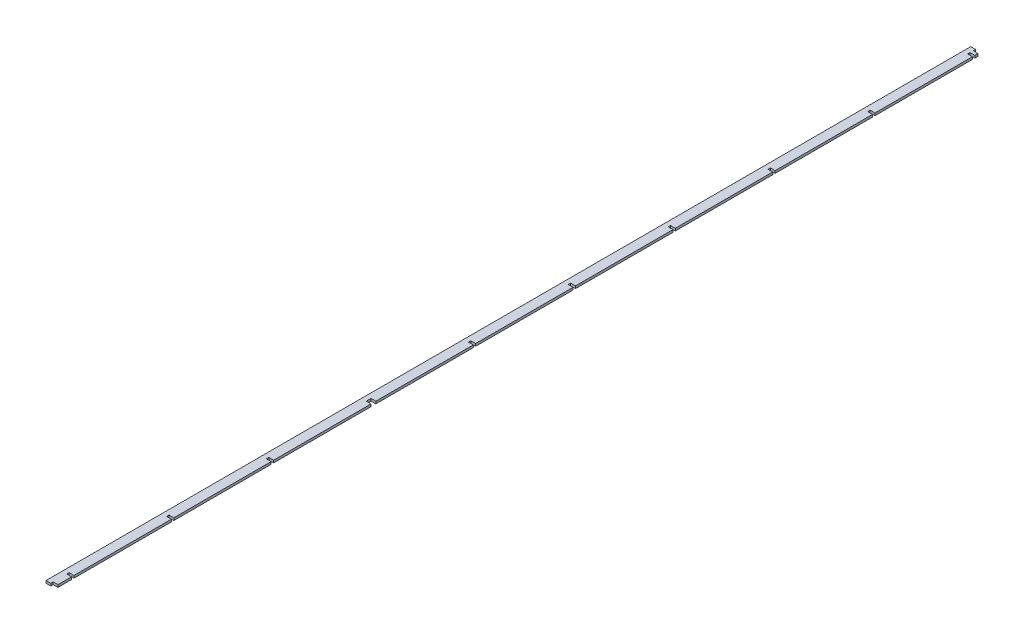
from build123d import *

# Parameters (mm, degrees)
SKETCH_1_W          = 12
SKETCH_1_H          = 3
EXTRUDE_1_DEPTH     = 1158
SKETCH_3_W          = 6
SKETCH_3_H          = 3.01
SKETCH_3_H_2        = 2.99
SKETCH_3_H_3        = 3
SKETCH_3_H_4        = 6
CUT_EXTRUDE_1_DEPTH = 1167.094503421


with BuildPart() as part:
    # 草图1 → 凸台-拉伸1 (new body)
    with BuildSketch(Plane.XY):
        with Locations((-131.125456821, -6.801880905)):
            Rectangle(SKETCH_1_W, SKETCH_1_H)
    extrude(amount=EXTRUDE_1_DEPTH)

    # 草图3 → 切除-拉伸1 (cut, through all)
    with BuildSketch(Plane(origin=(0, -5.301880905, 0), x_dir=(1, 0, 0), z_dir=(0, 1, 0))):
        with Locations((-128.125456821, -1.505)):
            Rectangle(SKETCH_3_W, SKETCH_3_H)
        with Locations((-128.125456821, -1156.505)):
            Rectangle(SKETCH_3_W, SKETCH_3_H_2)
        with Locations((-128.125456821, -1136.51)):
            Rectangle(SKETCH_3_W, SKETCH_3_H_3)
        with Locations((-128.125456821, -1011.51)):
            Rectangle(SKETCH_3_W, SKETCH_3_H_3)
        with Locations((-128.125456821, -886.51)):
            Rectangle(SKETCH_3_W, SKETCH_3_H_3)
        with Locations((-128.125456821, -760.01)):
            Rectangle(SKETCH_3_W, SKETCH_3_H_4)
        with Locations((-128.125456821, -633.51)):
            Rectangle(SKETCH_3_W, SKETCH_3_H_3)
        with Locations((-128.125456821, -508.51)):
            Rectangle(SKETCH_3_W, SKETCH_3_H_3)
        with Locations((-128.125456821, -383.51)):
            Rectangle(SKETCH_3_W, SKETCH_3_H_3)
        with Locations((-128.125456821, -258.51)):
            Rectangle(SKETCH_3_W, SKETCH_3_H_3)
        with Locations((-128.125456821, -133.51)):
            Rectangle(SKETCH_3_W, SKETCH_3_H_3)
        with Locations((-128.125456821, -8.51)):
            Rectangle(SKETCH_3_W, SKETCH_3_H_3)
    extrude(amount=-CUT_EXTRUDE_1_DEPTH, mode=Mode.SUBTRACT)


solid = part.part
